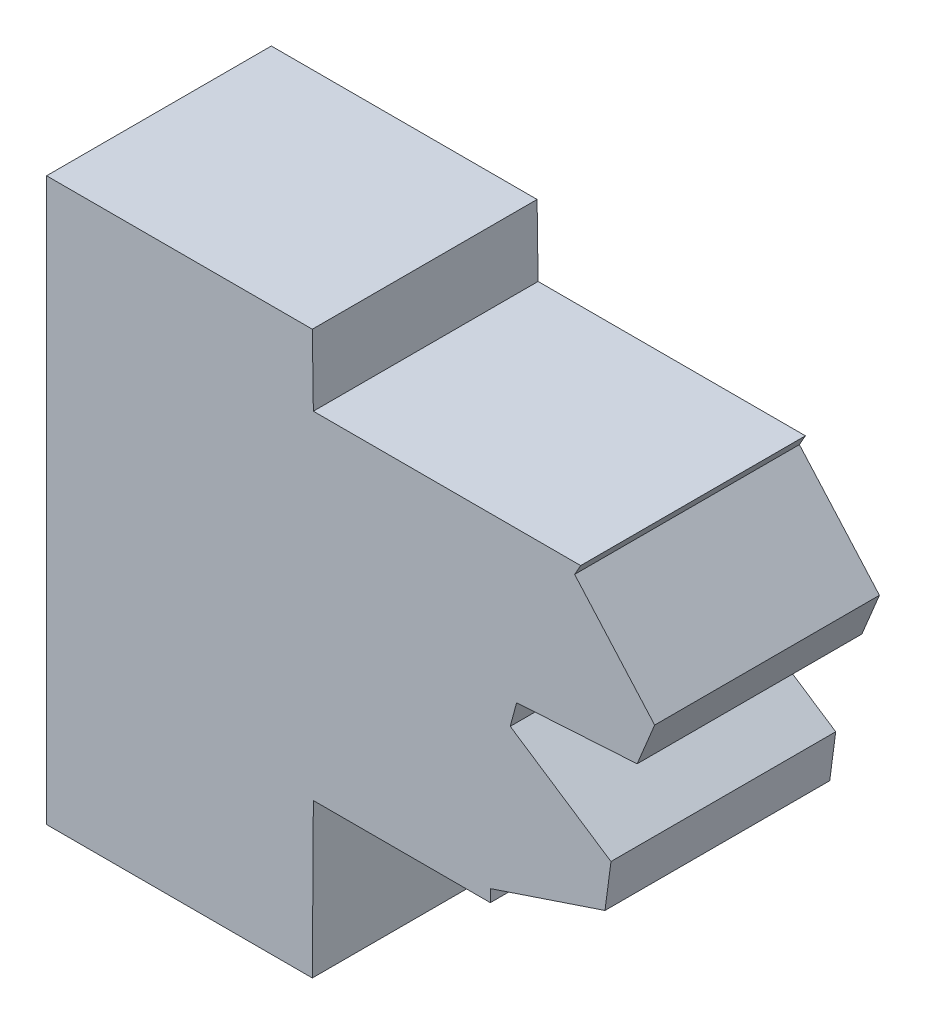
from build123d import *

# Parameters (mm, degrees)
BOSS_EXTRUDE1_DEPTH = 4


with BuildPart() as part:
    # Sketch1 → Boss-Extrude1 (new body)
    with BuildSketch(Plane.XY):
        Polygon((0.017783705, 2.744764558), (3.167783705, 2.744764558), (3.169765634, 2.962852563), (5.208366051, 3.644764558), (5.314787838, 4.453118281), (3.522142857, 5.639423302), (3.635033516, 6.060736975), (5.780662119, 6.191784769), (6.09267501, 6.945050522), (4.668151258, 8.554903841), (4.77547886, 8.744764558), (0.017783705, 8.744764558), (0, 10), (-4.73, 10), (-4.73, 0), (0, 0), align=None)
    extrude(amount=BOSS_EXTRUDE1_DEPTH)


solid = part.part
